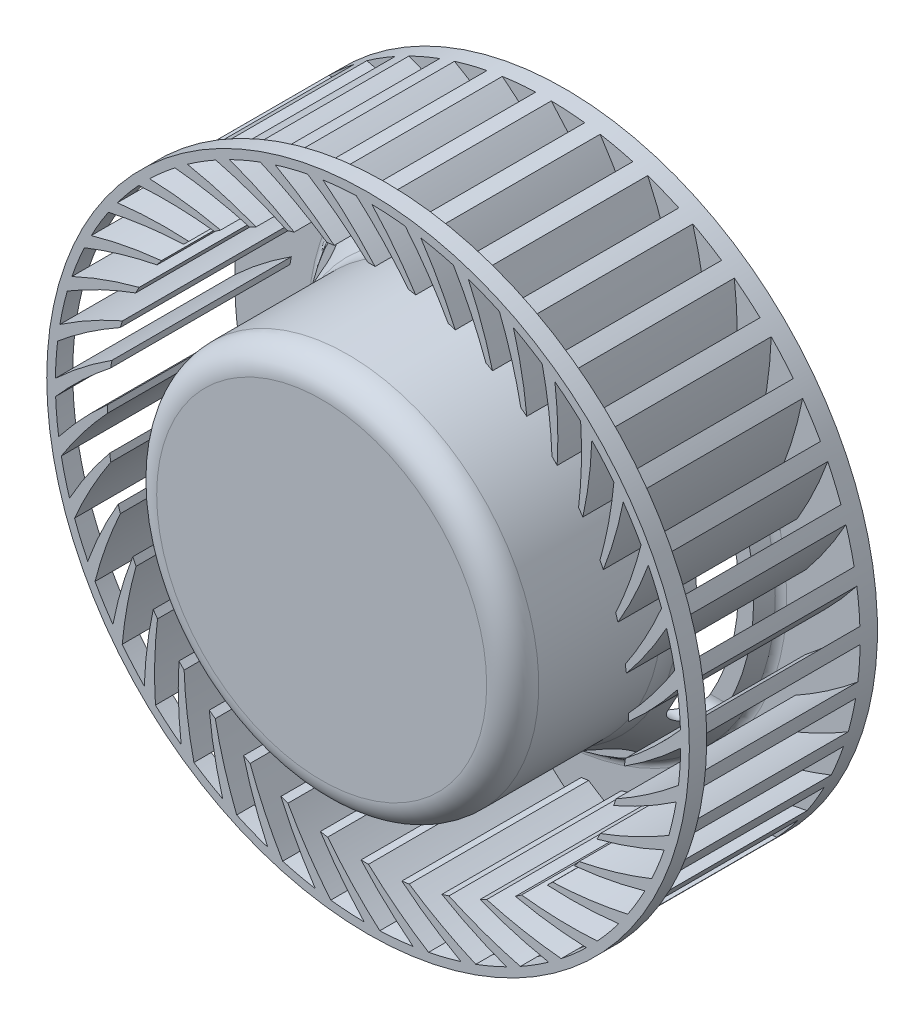
from build123d import *

# Parameters (mm, degrees)
CUT_EXTRUDE2_REACH             = 28.41
CUT_EXTRUDE2_DIRECTION_2_REACH = 28.41
CIRPATTERN1_COUNT              = 2
CIRPATTERN1_ANGLE              = 90
BOSS_EXTRUDE1_DEPTH            = 9.39
CIRPATTERN2_COUNT              = 40
BOSS_EXTRUDE2_START            = -0.909091
SKETCH5_R                      = 16.818182
SKETCH5_R_2                    = 16.363636
BOSS_EXTRUDE2_DEPTH            = 0.909091


with BuildPart() as part:
    # Sketch2 → Revolve1 (revolve)
    with BuildSketch(Plane(origin=(0, 0, 0), x_dir=(0, 0, -1), z_dir=(1, 0, 0))):
        with BuildLine():
            Line((-0.909087224, 16.363638299), (0, 16.363638299))
            Line((0, 16.363638299), (0, 12.25000051))
            Line((0, 12.25000051), (-0.260590799, 12.25000051))
            ThreePointArc((-0.260590799, 12.25000051), (-0.443767777, 11.855957399), (-0.761452054, 11.559477251))
            Line((-0.761452054, 11.559477251), (-3.850872017, 9.628993401))
            ThreePointArc((-3.850872017, 9.628993401), (-4.370994103, 9.397420129), (-4.934797785, 9.318182688))
            Line((-4.934797785, 9.318182688), (-11.362613017, 9.318182688))
            ThreePointArc((-11.362613017, 9.318182688), (-11.844731276, 9.118482767), (-12.044431198, 8.636364507))
            Line((-12.044431198, 8.636364507), (-12.044431198, 0))
            Line((-12.044431198, 0), (-12.72624938, 0))
            Line((-12.72624938, 0), (-12.72624938, 8.636364507))
            ThreePointArc((-12.72624938, 8.636364507), (-12.326849536, 9.600601026), (-11.362613017, 10.00000087))
            Line((-11.362613017, 10.00000087), (-4.934797785, 10.00000087))
            ThreePointArc((-4.934797785, 10.00000087), (-4.558928664, 10.05282583), (-4.212180607, 10.207208012))
            Line((-4.212180607, 10.207208012), (-1.122760643, 12.137691862))
            ThreePointArc((-1.122760643, 12.137691862), (-0.966078361, 12.302800537), (-0.909087224, 12.523168915))
            Line((-0.909087224, 12.523168915), (-0.909087224, 16.363638299))
        make_face()
    revolve(axis=Axis((0, 0, 0), (0, 0, 1)))

    # Sketch3 → Cut-Extrude2 (cut, up to next)
    with BuildSketch(Plane(origin=(0, 0, 0), x_dir=(0, 0, -1), z_dir=(1, 0, 0)), mode=Mode.PRIVATE) as cut_extrude2_sk1:
        with BuildLine():
            Line((-1.81818182, -5.454545455), (-1.81818182, 5.454545455))
            ThreePointArc((-1.81818182, 5.454545455), (-2.727272729, 6.363636364), (-3.636363638, 5.454545455))
            Line((-3.636363638, 5.454545455), (-3.636363638, -5.454545455))
            ThreePointArc((-3.636363638, -5.454545455), (-2.727272729, -6.363636364), (-1.81818182, -5.454545455))
        make_face()
    cut_extrude2_tool1 = extrude(cut_extrude2_sk1.sketch, amount=-CUT_EXTRUDE2_REACH, mode=Mode.PRIVATE) & part.part
    cut_extrude2 = cut_extrude2_tool1.solids().sort_by_distance((0, 0, 2.727273))[0]
    add(cut_extrude2, mode=Mode.SUBTRACT)

    # Sketch3 → Cut-Extrude2 direction 2 (cut, up to next)
    with BuildSketch(Plane(origin=(0, 0, 0), x_dir=(0, 0, -1), z_dir=(1, 0, 0)), mode=Mode.PRIVATE) as cut_extrude2_direction_2_sk1:
        with BuildLine():
            Line((-1.81818182, -5.454545455), (-1.81818182, 5.454545455))
            ThreePointArc((-1.81818182, 5.454545455), (-2.727272729, 6.363636364), (-3.636363638, 5.454545455))
            Line((-3.636363638, 5.454545455), (-3.636363638, -5.454545455))
            ThreePointArc((-3.636363638, -5.454545455), (-2.727272729, -6.363636364), (-1.81818182, -5.454545455))
        make_face()
    cut_extrude2_direction_2_tool1 = extrude(cut_extrude2_direction_2_sk1.sketch, amount=CUT_EXTRUDE2_DIRECTION_2_REACH, mode=Mode.PRIVATE) & part.part
    cut_extrude2_direction_2 = cut_extrude2_direction_2_tool1.solids().sort_by_distance((0, 0, 2.727273))[0]
    add(cut_extrude2_direction_2, mode=Mode.SUBTRACT)

    # CirPattern1: Cut-Extrude2, Cut-Extrude2 direction 2 ×2 about axis
    cirpattern1_axis = Axis((0, 0, 0), (0, 0, -1))
    add([cut_extrude2.rotate(cirpattern1_axis, i * CIRPATTERN1_ANGLE / (CIRPATTERN1_COUNT - 1)) for i in range(1, CIRPATTERN1_COUNT)], mode=Mode.SUBTRACT)
    add([cut_extrude2_direction_2.rotate(cirpattern1_axis, i * CIRPATTERN1_ANGLE / (CIRPATTERN1_COUNT - 1)) for i in range(1, CIRPATTERN1_COUNT)], mode=Mode.SUBTRACT)

    # Sketch4 → Boss-Extrude1 (add)
    with BuildSketch(Plane.XY.offset(0.909087224)):
        with BuildLine():
            ThreePointArc((13.471822525, -2.111968529), (14.974162929, -0.814041662), (16.352063961, 0.615304198))
            ThreePointArc((16.352063961, 0.615304198), (16.362326594, 0.207034952), (16.362397376, -0.201363253))
            ThreePointArc((16.362397376, -0.201363253), (14.936650502, -1.415336323), (13.40627619, -2.494428178))
            ThreePointArc((13.40627619, -2.494428178), (13.440409833, -2.303431513), (13.471822525, -2.111968529))
        make_face()
    boss_extrude1 = extrude(amount=BOSS_EXTRUDE1_DEPTH)

    # CirPattern2: Boss-Extrude1 ×40 about axis
    cirpattern2_axis = Axis((0, 0, 0.909087224), (0, 0, -1))
    for i in range(1, CIRPATTERN2_COUNT):
        add(boss_extrude1.rotate(cirpattern2_axis, i * 360 / CIRPATTERN2_COUNT))


with BuildPart() as boss_extrude2_tool:
    # Sketch5 → Boss-Extrude2 (new body)
    with BuildSketch(Plane.XY.offset(10.299087224).offset(BOSS_EXTRUDE2_START)):
        Circle(SKETCH5_R)
        Circle(SKETCH5_R_2, mode=Mode.SUBTRACT)
    extrude(amount=BOSS_EXTRUDE2_DEPTH)


with BuildPart() as part_1:
    add(part.part)


with BuildPart() as part_2:
    # Boss-Extrude2: joined with boss_extrude2_tool
    add(part_1.part.fuse(boss_extrude2_tool.part, tol=0.00001))


solid = part_2.part
